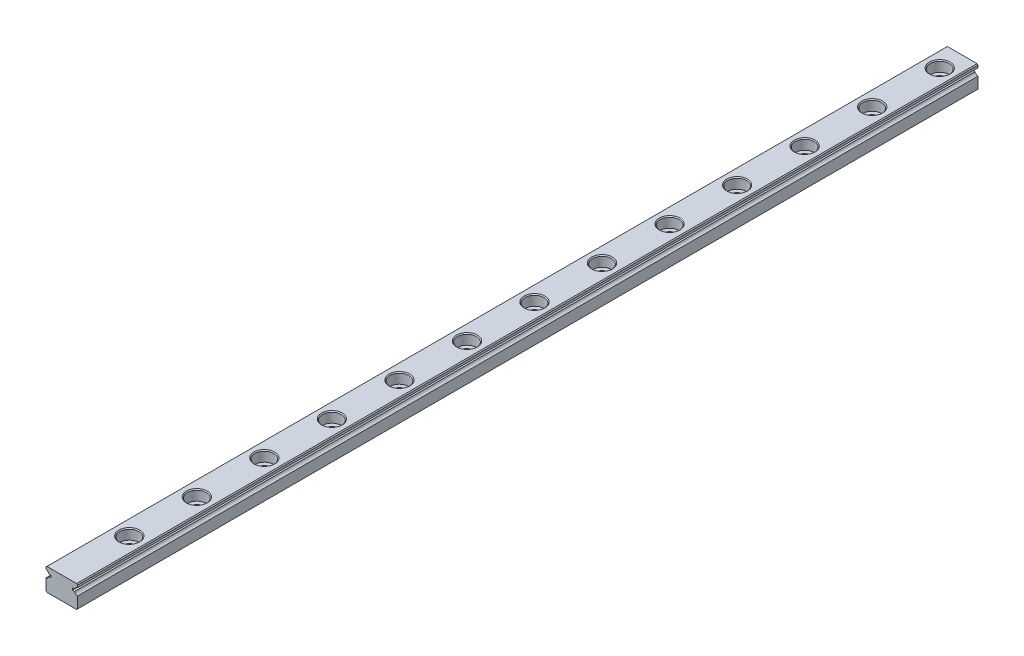
from build123d import *

# Parameters (mm, degrees)
EXTRUDE1_DEPTH             = 200
EXTRUDE2_REACH             = 202.093
SKETCH2_R                  = 1.2
SKETCH_R                   = 2.1
SKETCH_R_2                 = 1.2
EXTRUDE4_DEPTH             = 2.3
CHAMFER1_SIZE              = 0.2
LPATTERN1_COUNT            = 13
LPATTERN1_PITCH            = 15
CHAMFER1_OF_LPATTERN1_SIZE = 0.2


with BuildPart() as part:
    # Sketch1 → Extrude1 (new body)
    with BuildSketch(Plane.XY):
        with BuildLine():
            Line((-3.3, -2.5), (3.3, -2.5))
            Line((3.3, -2.5), (3.5, -2.3))
            Line((3.5, -2.3), (3.5, 0.206274607))
            ThreePointArc((3.5, 0.206274607), (3.091294745, 0.382570681), (2.840065792, 0.75))
            Line((2.840065792, 0.75), (2.340065792, 0.75))
            Line((2.340065792, 0.75), (2.340065792, 1.25))
            Line((2.340065792, 1.25), (2.840065792, 1.25))
            ThreePointArc((2.840065792, 1.25), (3.091294745, 1.617429319), (3.5, 1.793725393))
            Line((3.5, 1.793725393), (3.5, 2.3))
            Line((3.5, 2.3), (3.3, 2.5))
            Line((3.3, 2.5), (-3.3, 2.5))
            Line((-3.3, 2.5), (-3.5, 2.3))
            Line((-3.5, 2.3), (-3.5, 1.793725393))
            ThreePointArc((-3.5, 1.793725393), (-3.091294745, 1.617429319), (-2.840065792, 1.25))
            Line((-2.840065792, 1.25), (-2.340065792, 1.25))
            Line((-2.340065792, 1.25), (-2.340065792, 0.75))
            Line((-2.340065792, 0.75), (-2.840065792, 0.75))
            ThreePointArc((-2.840065792, 0.75), (-3.091294745, 0.382570681), (-3.5, 0.206274607))
            Line((-3.5, 0.206274607), (-3.5, -2.3))
            Line((-3.5, -2.3), (-3.3, -2.5))
        make_face()
    extrude(amount=EXTRUDE1_DEPTH)

    # Sketch2 → Extrude2 (cut, up to next)
    with BuildSketch(Plane(origin=(0, 2.5, 0), x_dir=(1, 0, 0), z_dir=(0, 1, 0)), mode=Mode.PRIVATE) as extrude2_sk1:
        with Locations((0, -5)):
            Circle(SKETCH2_R)
    extrude2_tool1 = extrude(extrude2_sk1.sketch, amount=-EXTRUDE2_REACH, mode=Mode.PRIVATE) & part.part
    extrude2 = extrude2_tool1.solids().sort_by_distance((0, 2.5, 5))[0]
    add(extrude2, mode=Mode.SUBTRACT)

    # Sketch → Extrude4 (cut)
    with BuildSketch(Plane(origin=(0, 2.5, 0), x_dir=(1, 0, 0), z_dir=(0, 1, 0))):
        with Locations((0, -5)):
            Circle(SKETCH_R)
        with Locations((0, -5)):
            Circle(SKETCH_R_2, mode=Mode.SUBTRACT)
    extrude4 = extrude(amount=-EXTRUDE4_DEPTH, mode=Mode.SUBTRACT)

    # Chamfer1
    chamfer1_edges = [part.edges().sort_by_distance(p)[0] for p in [
        (-1.2, -2.5, 5),
        (-2.1, 2.5, 5),
    ]]
    chamfer(chamfer1_edges, length=CHAMFER1_SIZE)

    # LPattern1: Extrude2, Extrude4 ×13
    with Locations(*[(0, 0, i * LPATTERN1_PITCH) for i in range(1, LPATTERN1_COUNT)]):
        add(extrude2, mode=Mode.SUBTRACT)
        add(extrude4, mode=Mode.SUBTRACT)

    # Chamfer1 of LPattern1
    chamfer1_of_lpattern1_edges = [part.edges().sort_by_distance(p)[0] for p in [
        (-1.2, -2.5, 20),
        (-2.1, 2.5, 20),
        (-1.2, -2.5, 35),
        (-2.1, 2.5, 35),
        (-1.2, -2.5, 50),
        (-2.1, 2.5, 50),
        (-1.2, -2.5, 65),
        (-2.1, 2.5, 65),
        (-1.2, -2.5, 80),
        (-2.1, 2.5, 80),
        (-1.2, -2.5, 95),
        (-2.1, 2.5, 95),
        (-1.2, -2.5, 110),
        (-2.1, 2.5, 110),
        (-1.2, -2.5, 125),
        (-2.1, 2.5, 125),
        (-1.2, -2.5, 140),
        (-2.1, 2.5, 140),
        (-1.2, -2.5, 155),
        (-2.1, 2.5, 155),
        (-1.2, -2.5, 170),
        (-2.1, 2.5, 170),
        (-1.2, -2.5, 185),
        (-2.1, 2.5, 185),
    ]]
    chamfer(chamfer1_of_lpattern1_edges, length=CHAMFER1_OF_LPATTERN1_SIZE)


solid = part.part
